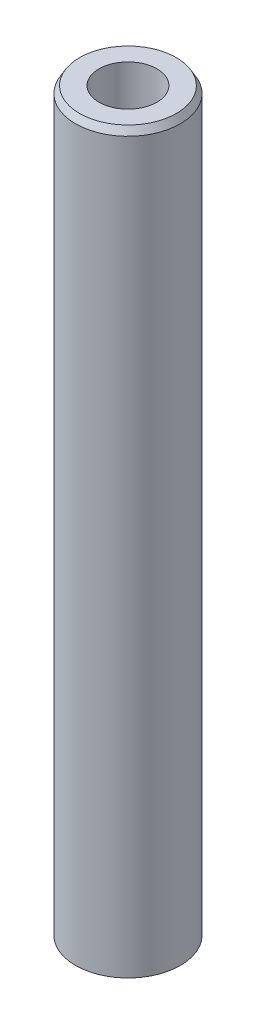
from build123d import *
from OCP.BRepFilletAPI import BRepFilletAPI_MakeChamfer

# Parameters (mm, degrees)
SKETCH1_R           = 42.5
BOSS_EXTRUDE1_DEPTH = 600
SKETCH2_R           = 23.502801483
CUT_EXTRUDE1_DEPTH  = 604.002902149
CHAMFER1_SIZE       = 5.622173916
CHAMFER1_SIZE2      = 3.245963624


with BuildPart() as part:
    # Sketch1 → Boss-Extrude1 (new body)
    with BuildSketch(Plane(origin=(0, 0, 0), x_dir=(1, 0, 0), z_dir=(0, 1, 0))):
        Circle(SKETCH1_R)
    extrude(amount=BOSS_EXTRUDE1_DEPTH)

    # Sketch2 → Cut-Extrude1 (cut, through all)
    with BuildSketch(Plane(origin=(0, 0, 0), x_dir=(1, 0, 0), z_dir=(0, 1, 0))):
        Circle(SKETCH2_R)
    extrude(amount=CUT_EXTRUDE1_DEPTH, mode=Mode.SUBTRACT)

    # Chamfer1: one chamfer whose edges measure the first distance from different faces: ONE call of the kernel's chamfer builder (chamfer() names one face for all edges)
    chamfer1_edges_1 = [part.edges().sort_by_distance(p)[0] for p in [
        (-42.5, 600, 0),
    ]]
    chamfer1_side_1 = [part.faces().sort_by_distance(p)[0] for p in [
        (-42.5, 300, 0),
    ]]
    chamfer1_edges_2 = [part.edges().sort_by_distance(p)[0] for p in [
        (-42.5, 0, 0),
    ]]
    chamfer1_side_2 = [part.faces().sort_by_distance(p)[0] for p in [
        (-41.297918472, 0, 0),
    ]]
    chamfer1 = BRepFilletAPI_MakeChamfer(part.part.solid().wrapped)
    for e in chamfer1_edges_1:
        chamfer1.Add(CHAMFER1_SIZE, CHAMFER1_SIZE2, e.wrapped, chamfer1_side_1[0].wrapped)  # the first distance lies on this face
    for e in chamfer1_edges_2:
        chamfer1.Add(CHAMFER1_SIZE, CHAMFER1_SIZE2, e.wrapped, chamfer1_side_2[0].wrapped)  # the first distance lies on this face
    add(Compound.cast(chamfer1.Shape()), mode=Mode.REPLACE)


solid = part.part
